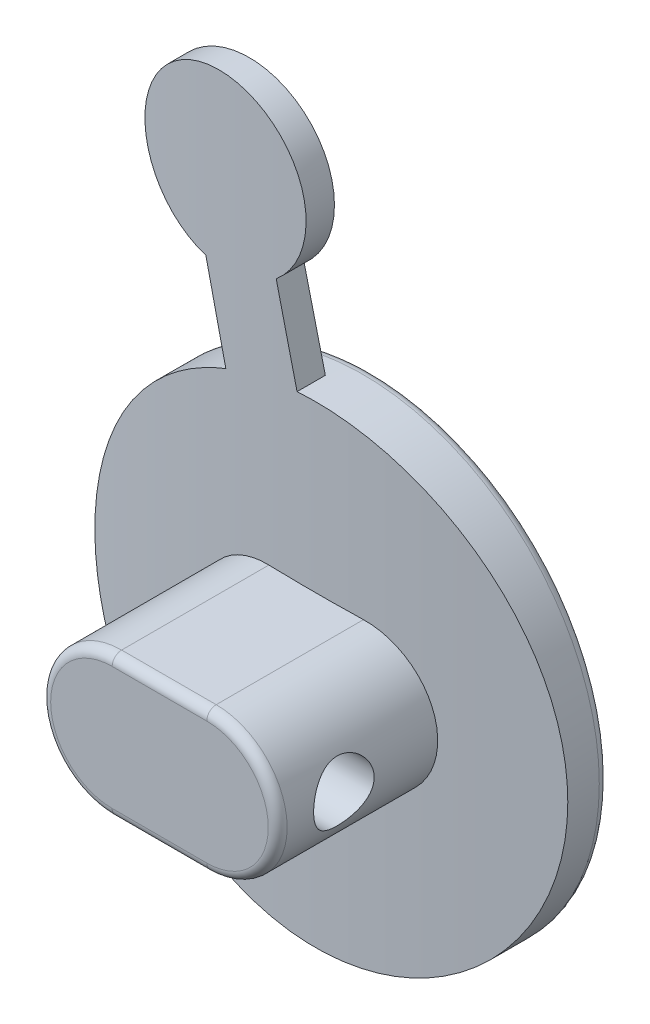
from build123d import *

# Parameters (mm, degrees)
AUFSATZ_LINEAR_START             = -2.5
SKIZZE2_R                        = 25
AUFSATZ_LINEAR_AUSTRAGEN1_DEPTH  = 6
AUFSATZ_LINEAR_START_2           = -5.5
AUFSATZ_LINEAR_AUSTRAGEN6_DEPTH  = 3
SCHNITT_LINEAR_AUSTRAGEN2_DEPTH  = 478.699958133
AUFSATZ_LINEAR_START_3           = -2.916019
AUFSATZ_LINEAR_AUSTRAGEN5_DEPTH  = 16.916019
SPIEGELN4_START                  = -2.916018908
SPIEGELN4_DEPTH                  = 16.916018908
F_6_4_6_4_DURCHMESSER_BOHRUNG1_D = 6.4
VERRUNDUNG2_R                    = 1


# Read off the part's stored shape, not the designer's step: Spiegeln4
with BuildPart() as part:
    # Skizze2 → Aufsatz-Linear austragen1 (new body)
    with BuildSketch(Plane.XY.offset(AUFSATZ_LINEAR_START)):
        with Locations((450, 0)):
            Circle(SKIZZE2_R)
    extrude(amount=-AUFSATZ_LINEAR_AUSTRAGEN1_DEPTH)

    # Skizze10 → Aufsatz-Linear austragen6 (add)
    with BuildSketch(Plane.XY.offset(AUFSATZ_LINEAR_START_2)):
        with BuildLine():
            Line((448.038494427, 24.922931126), (445.796483155, 34.115177342))
            ThreePointArc((445.796483155, 34.115177342), (437.867394378, 49.743683049), (438.024320445, 32.2195279))
            Line((438.024320445, 32.2195279), (440.266331717, 23.027281684))
            ThreePointArc((440.266331717, 23.027281684), (444.076095495, 24.28800847), (448.038494427, 24.922931126))
        make_face()
    extrude(amount=AUFSATZ_LINEAR_AUSTRAGEN6_DEPTH)

    # Skizze8 → Schnitt-Linear austragen2 (cut, symmetric)
    with BuildSketch(Plane(origin=(0, 0, 0), x_dir=(1, 0, 0), z_dir=(0, 1, 0))):
        with BuildLine():
            Line((475, 2.5), (450, 2.5))
            ThreePointArc((450, 2.5), (462.527846235, 2.917876468), (475, 4.169648205))
            Line((475, 4.169648205), (475, 2.5))
        make_face()
    schnitt_linear_austragen2 = extrude(amount=SCHNITT_LINEAR_AUSTRAGEN2_DEPTH, both=True, mode=Mode.SUBTRACT)

    # Spiegeln1: Schnitt-Linear austragen2 across plane
    add(schnitt_linear_austragen2.mirror(Plane(origin=(450, 0, 0), x_dir=(0, 0, 1), z_dir=(1, 0, 0))), mode=Mode.SUBTRACT)

    # Skizze3 → Aufsatz-Linear austragen5 (add)
    with BuildSketch(Plane.XY.offset(AUFSATZ_LINEAR_START_3)):
        with BuildLine():
            Line((450, 0), (462.5, 0))
            ThreePointArc((462.5, 0), (460.303300859, 5.303300859), (455, 7.5))
            Line((455, 7.5), (450, 7.5))
            Line((450, 7.5), (450, 0))
        make_face()
    extrude(amount=AUFSATZ_LINEAR_AUSTRAGEN5_DEPTH)

    # Spiegeln4 outline → Spiegeln4 (add)
    with BuildSketch(Plane.XY.offset(SPIEGELN4_START)):
        with BuildLine():
            ThreePointArc((455, -7.5), (460.303300859, -5.303300859), (462.5, 0))
            Line((462.5, 0), (450, 0))
            Line((450, 0), (450, 7.5))
            Line((450, 7.5), (445, 7.5))
            ThreePointArc((445, 7.5), (437.5, 0), (445, -7.5))
            Line((445, -7.5), (455, -7.5))
        make_face()
    extrude(amount=SPIEGELN4_DEPTH)

    # Skizze4 → Rotation1 (revolve)
    with BuildSketch(Plane(origin=(450, 0, 0), x_dir=(0, 0, -1), z_dir=(1, 0, 0)), mode=Mode.PRIVATE) as rotation1_sk:
        Polygon((9.5, 7), (8.5, 7), (8.5, 0), (18.5, 0), (18.5, 4), (18.5, 5), (9.5, 5), align=None)
    revolve(rotation1_sk.sketch.rotate(Axis((450, 0, -8.5), (0, 0, -1)), 90), axis=Axis((450, 0, -8.5), (0, 0, -1)))

    # Ø6.4 (6.4) Durchmesser Bohrung1 (through all)
    with Locations(Plane(origin=(462.5, 0, 0), x_dir=(0, 0, -1), z_dir=(1, 0, 0))):
        with Locations((-7, 0)):
            Hole(F_6_4_6_4_DURCHMESSER_BOHRUNG1_D / 2)

    # Verrundung2
    verrundung2_edges = [part.edges().sort_by_distance(p)[0] for p in [
        (437.5, 0, 14),
        (445, 0, -18.5),
        (425, 0, -8.5),
        (460.303300859, 5.303300859, 14),
        (450, 7.5, 14),
        (450, -7.5, 14),
    ]]
    fillet(verrundung2_edges, radius=VERRUNDUNG2_R)


solid = part.part
